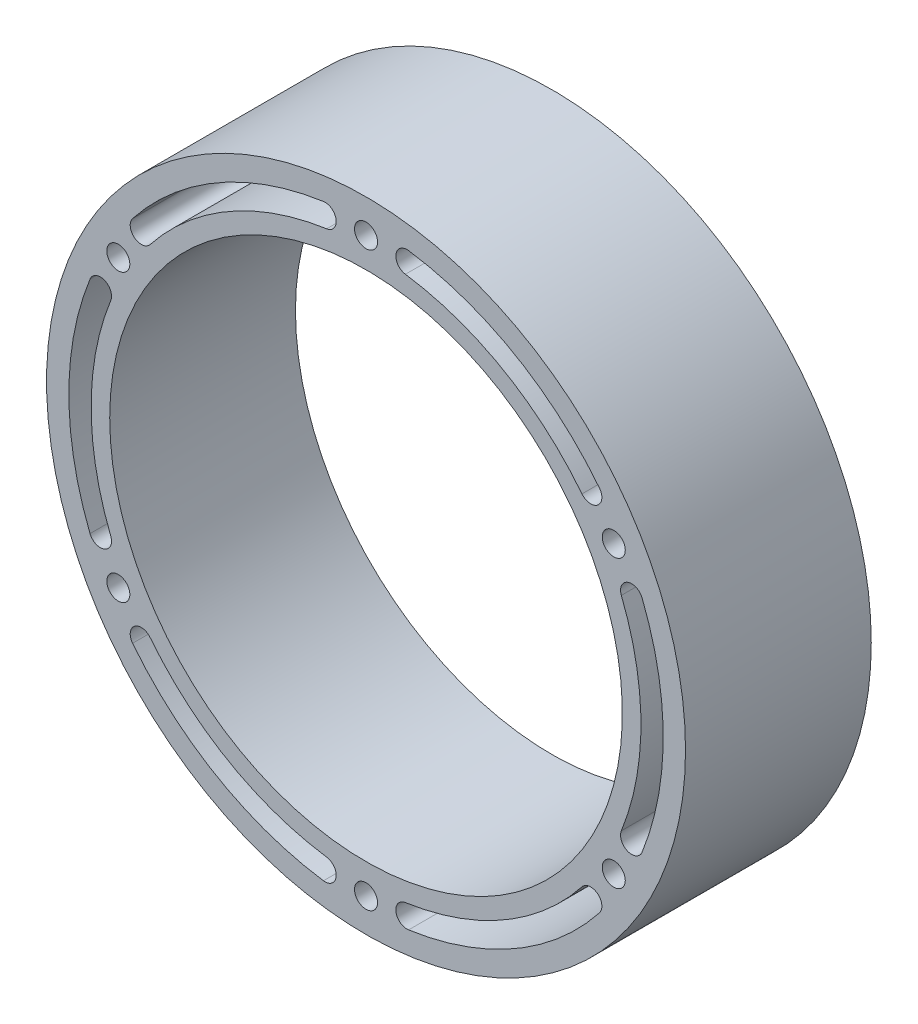
from build123d import *

# Parameters (mm, degrees)
HOLE_START                        = -12.5
HOLE_WIZARD_3_1_3_1_6_OUTLINE_R   = 43
HOLE_WIZARD_3_1_3_1_6_OUTLINE_R_2 = 1.55
HOLE_WIZARD_3_1_3_1_6_DEPTH       = 25
HOLE_WIZARD_3_1_3_1_5_D           = 3.1
HOLE_WIZARD_3_1_3_1_4_D           = 3.1
HOLE_WIZARD_3_1_3_1_3_D           = 3.1
HOLE_WIZARD_3_1_3_1_2_D           = 3.1
HOLE_WIZARD_3_1_3_1_1_D           = 3.1
HOLE_WIZARD_M64_1_D               = 69


with BuildPart() as part:
    # Ø3.1 (3.1) 直径孔6: read off the stored shape, not the designer's step
    # Ø3.1 (3.1) 直径孔6 outline → Ø3.1 (3.1) 直径孔6 (new body)
    with BuildSketch(Plane.XY.offset(HOLE_START)):
        Circle(HOLE_WIZARD_3_1_3_1_6_OUTLINE_R)
        with BuildLine():
            ThreePointArc((-31.420080332, -24.7543643), (-31.170115981, -22.647822626), (-29.063574308, -22.897786978))
            ThreePointArc((-29.063574308, -22.897786978), (-18.5, -32.04293994), (-5.298278059, -36.618687164))
            ThreePointArc((-5.298278059, -36.618687164), (-4.028531744, -38.318023592), (-5.727868172, -39.587769907))
            ThreePointArc((-5.727868172, -39.587769907), (-20, -34.641016151), (-31.420080332, -24.7543643))
        make_face(mode=Mode.SUBTRACT)
        with Locations((0, -38.5)):
            Circle(HOLE_WIZARD_3_1_3_1_6_OUTLINE_R_2, mode=Mode.SUBTRACT)
        with BuildLine():
            ThreePointArc((5.727868172, -39.587769907), (4.028531744, -38.318023592), (5.298278059, -36.618687164))
            ThreePointArc((5.298278059, -36.618687164), (18.5, -32.04293994), (29.063574308, -22.897786978))
            ThreePointArc((29.063574308, -22.897786978), (31.170115981, -22.647822626), (31.420080332, -24.7543643))
            ThreePointArc((31.420080332, -24.7543643), (20, -34.641016151), (5.727868172, -39.587769907))
        make_face(mode=Mode.SUBTRACT)
        with BuildLine():
            ThreePointArc((-37.147948505, 14.833405607), (-35.198647726, 15.670200965), (-34.361852367, 13.720900186))
            ThreePointArc((-34.361852367, 13.720900186), (-37, 0), (-34.361852367, -13.720900186))
            ThreePointArc((-34.361852367, -13.720900186), (-35.198647726, -15.670200965), (-37.147948505, -14.833405607))
            ThreePointArc((-37.147948505, -14.833405607), (-40, 0), (-37.147948505, 14.833405607))
        make_face(mode=Mode.SUBTRACT)
        with BuildLine():
            ThreePointArc((-5.727868172, 39.587769907), (-4.028531744, 38.318023592), (-5.298278059, 36.618687164))
            ThreePointArc((-5.298278059, 36.618687164), (-18.5, 32.04293994), (-29.063574308, 22.897786978))
            ThreePointArc((-29.063574308, 22.897786978), (-31.170115981, 22.647822626), (-31.420080332, 24.7543643))
            ThreePointArc((-31.420080332, 24.7543643), (-20, 34.641016151), (-5.727868172, 39.587769907))
        make_face(mode=Mode.SUBTRACT)
        with BuildLine():
            ThreePointArc((37.147948505, -14.833405607), (35.198647726, -15.670200965), (34.361852367, -13.720900186))
            ThreePointArc((34.361852367, -13.720900186), (37, 0), (34.361852367, 13.720900186))
            ThreePointArc((34.361852367, 13.720900186), (35.198647726, 15.670200965), (37.147948505, 14.833405607))
            ThreePointArc((37.147948505, 14.833405607), (40, 0), (37.147948505, -14.833405607))
        make_face(mode=Mode.SUBTRACT)
        with BuildLine():
            ThreePointArc((31.420080332, 24.7543643), (31.170115981, 22.647822626), (29.063574308, 22.897786978))
            ThreePointArc((29.063574308, 22.897786978), (18.5, 32.04293994), (5.298278059, 36.618687164))
            ThreePointArc((5.298278059, 36.618687164), (4.028531744, 38.318023592), (5.727868172, 39.587769907))
            ThreePointArc((5.727868172, 39.587769907), (20, 34.641016151), (31.420080332, 24.7543643))
        make_face(mode=Mode.SUBTRACT)
    extrude(amount=HOLE_WIZARD_3_1_3_1_6_DEPTH)

    # Ø3.1 (3.1) 直径孔5 (through all)
    with Locations(Plane.XY.offset(12.5)):
        with Locations((33.341978046, -19.25)):
            Hole(HOLE_WIZARD_3_1_3_1_5_D / 2)

    # Ø3.1 (3.1) 直径孔4 (through all)
    with Locations(Plane.XY.offset(12.5)):
        with Locations((33.341978046, 19.25)):
            Hole(HOLE_WIZARD_3_1_3_1_4_D / 2)

    # Ø3.1 (3.1) 直径孔3 (through all)
    with Locations(Plane.XY.offset(12.5)):
        with Locations((0, 38.5)):
            Hole(HOLE_WIZARD_3_1_3_1_3_D / 2)

    # Ø3.1 (3.1) 直径孔2 (through all)
    with Locations(Plane.XY.offset(12.5)):
        with Locations((-33.341978046, 19.25)):
            Hole(HOLE_WIZARD_3_1_3_1_2_D / 2)

    # Ø3.1 (3.1) 直径孔1 (through all)
    with Locations(Plane.XY.offset(12.5)):
        with Locations((-33.341978046, -19.25)):
            Hole(HOLE_WIZARD_3_1_3_1_1_D / 2)

    # M64 间隙孔1 (through all)
    with Locations(Plane(origin=(0, 0, -12.5), x_dir=(-1, 0, 0), z_dir=(0, 0, -1))):
        with Locations((0, 0)):
            Hole(HOLE_WIZARD_M64_1_D / 2)


solid = part.part
